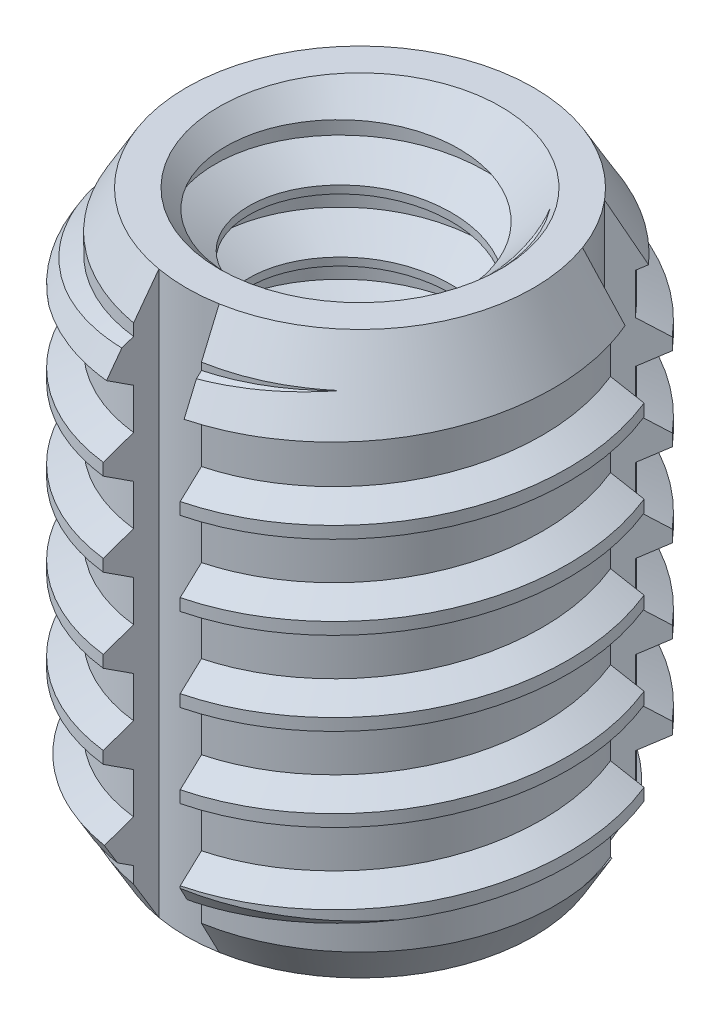
from build123d import *

# Parameters (mm, degrees)
SKETCH1_R         = 3.7592
EXTRUDE1_DEPTH    = 9.525
SKETCH4_R         = 1.725592336
EXTRUDE2_DEPTH    = 11.908198489
CHAMFER1_SIZE     = 0.661458333
CUT_SWEEP1_PITCH  = 1.058333333
CHAMFER2_SIZE     = 1.411111111
CHAMFER2_SIZE2    = 0.81470538
CHAMFER3_SIZE     = 1.411111111
CHAMFER3_SIZE2    = 0.81470538
CUT_SWEEP2_PITCH  = 1.411111111
EXTRUDE3_DEPTH    = 11.908198645
CIRPATTERN1_COUNT = 3


with BuildPart() as part:
    # Sketch1 → Extrude1 (new body)
    with BuildSketch(Plane(origin=(0, 0, 0), x_dir=(1, 0, 0), z_dir=(0, 1, 0))):
        with Locations(Location((0, 0, 0), (0, 0, 270))):
            Circle(SKETCH1_R)
    extrude(amount=-EXTRUDE1_DEPTH)

    # Sketch4 → Extrude2 (cut, through all)
    with BuildSketch(Plane(origin=(0, 0, 0), x_dir=(-1, 0, 0), z_dir=(0, 1, 0))):
        with Locations(Location((0, 0, 0), (0, 0, 90))):
            Circle(SKETCH4_R)
    extrude(amount=-EXTRUDE2_DEPTH, mode=Mode.SUBTRACT)

    # Chamfer1
    chamfer1_edges = [part.edges().sort_by_distance(p)[0] for p in [
        (0, -9.525, -1.725592336),
        (0, 0, -1.725592336),
    ]]
    chamfer(chamfer1_edges, length=CHAMFER1_SIZE)

    # Cut-Sweep1: the profile of Sketch3 screwed along a right-hand helix of 10 turns, 8 arcs to a turn; built about Z, then put on its axis
    cut_sweep1_z = Axis((0, 0, 0), (0, 0, 1))
    cut_sweep1_corners = [(2.298432056, 0, -0.5953125), (2.298432056, 0, -0.330729167), (1.668308364, 0, 0.033072917), (1.668308364, 0, -0.959114583)]
    with BuildLine(mode=Mode.PRIVATE) as cut_sweep1_profile:
        Line(cut_sweep1_corners[0], cut_sweep1_corners[1])
        Line(cut_sweep1_corners[1], cut_sweep1_corners[2])
        Line(cut_sweep1_corners[2], cut_sweep1_corners[3])
        Line(cut_sweep1_corners[3], cut_sweep1_corners[0])
    cut_sweep1_cap = Face(cut_sweep1_profile.wire())
    cut_sweep1_turn_angles = [0, 22.5, 45, 67.5, 90, 112.5, 135, 157.5, 180, 202.5, 225, 247.5, 270, 292.5, 315, 337.5, 360]
    cut_sweep1_turn_weights = [1, 0.9238795325112867, 1, 0.9238795325112867, 1, 0.9238795325112867, 1, 0.9238795325112867, 1, 0.9238795325112867, 1, 0.9238795325112867, 1, 0.9238795325112867, 1, 0.9238795325112867, 1]
    cut_sweep1_turn_rails = [Edge.make_bspline([Vector(p[0], p[1], 0).rotate(cut_sweep1_z, cut_sweep1_turn_angles[k]) / cut_sweep1_turn_weights[k] + Vector(0, 0, p[2] + CUT_SWEEP1_PITCH * cut_sweep1_turn_angles[k] / 360) for k in range(17)], [0, 0, 0, 1, 1, 2, 2, 3, 3, 4, 4, 5, 5, 6, 6, 7, 7, 8, 8, 8], 2, cut_sweep1_turn_weights) for p in cut_sweep1_corners]
    cut_sweep1_turn_sides = [Face.make_surface_from_curves(cut_sweep1_turn_rails[p[0]], cut_sweep1_turn_rails[p[1]]) for p in [(0, 1), (1, 2), (2, 3), (3, 0)]]
    cut_sweep1 = Plane(origin=(0, 0, 0), x_dir=(-1, 0, 0), z_dir=(0, -1, 0)) * Solid(Shell([*[p.moved(Location((0, 0, CUT_SWEEP1_PITCH * i))) for i in range(10) for p in cut_sweep1_turn_sides], cut_sweep1_cap, cut_sweep1_cap.rotate(cut_sweep1_z, 3600).moved(Location((0, 0, CUT_SWEEP1_PITCH * 3600 / 360)))]))
    add(cut_sweep1, mode=Mode.SUBTRACT)

    # Chamfer2
    chamfer2_edges = [part.edges().sort_by_distance(p)[0] for p in [
        (0, 0, -3.7592),
    ]]
    chamfer2_side = [part.faces().sort_by_distance(p)[0] for p in [
        (0, -4.7625, -3.7592),
    ]]
    chamfer(chamfer2_edges, length=CHAMFER2_SIZE, length2=CHAMFER2_SIZE2, reference=chamfer2_side[0])

    # Chamfer3
    chamfer3_edges = [part.edges().sort_by_distance(p)[0] for p in [
        (0, -9.525, -3.7592),
    ]]
    chamfer3_side = [part.faces().sort_by_distance(p)[0] for p in [
        (0, -5.468055556, -3.7592),
    ]]
    chamfer(chamfer3_edges, length=CHAMFER3_SIZE, length2=CHAMFER3_SIZE2, reference=chamfer3_side[0])

    # Cut-Sweep2: the profile of Sketch6 screwed along a right-hand helix of 7.5 turns, 8 arcs to a turn; built about Z, then put on its axis
    cut_sweep2_z = Axis((0, 0, 0), (0, 0, 1))
    cut_sweep2_corners = [(3.3147, 0, -0.950802571), (3.3147, 0, -0.256632195), (3.847394444, 0, 0.050919086), (3.847394444, 0, -1.258353852)]
    with BuildLine(mode=Mode.PRIVATE) as cut_sweep2_profile:
        Line(cut_sweep2_corners[0], cut_sweep2_corners[1])
        Line(cut_sweep2_corners[1], cut_sweep2_corners[2])
        Line(cut_sweep2_corners[2], cut_sweep2_corners[3])
        Line(cut_sweep2_corners[3], cut_sweep2_corners[0])
    cut_sweep2_cap = Face(cut_sweep2_profile.wire())
    cut_sweep2_turn_angles = [0, 22.5, 45, 67.5, 90, 112.5, 135, 157.5, 180, 202.5, 225, 247.5, 270, 292.5, 315, 337.5, 360]
    cut_sweep2_turn_weights = [1, 0.9238795325112867, 1, 0.9238795325112867, 1, 0.9238795325112867, 1, 0.9238795325112867, 1, 0.9238795325112867, 1, 0.9238795325112867, 1, 0.9238795325112867, 1, 0.9238795325112867, 1]
    cut_sweep2_turn_rails = [Edge.make_bspline([Vector(p[0], p[1], 0).rotate(cut_sweep2_z, cut_sweep2_turn_angles[k]) / cut_sweep2_turn_weights[k] + Vector(0, 0, p[2] + CUT_SWEEP2_PITCH * cut_sweep2_turn_angles[k] / 360) for k in range(17)], [0, 0, 0, 1, 1, 2, 2, 3, 3, 4, 4, 5, 5, 6, 6, 7, 7, 8, 8, 8], 2, cut_sweep2_turn_weights) for p in cut_sweep2_corners]
    cut_sweep2_turn_sides = [Face.make_surface_from_curves(cut_sweep2_turn_rails[p[0]], cut_sweep2_turn_rails[p[1]]) for p in [(0, 1), (1, 2), (2, 3), (3, 0)]]
    cut_sweep2_last_angles = [2520, 2542.5, 2565, 2587.5, 2610, 2632.5, 2655, 2677.5, 2700]
    cut_sweep2_last_weights = [1, 0.9238795325112867, 1, 0.9238795325112867, 1, 0.9238795325112867, 1, 0.9238795325112913, 1]
    cut_sweep2_last_rails = [Edge.make_bspline([Vector(p[0], p[1], 0).rotate(cut_sweep2_z, cut_sweep2_last_angles[k]) / cut_sweep2_last_weights[k] + Vector(0, 0, p[2] + CUT_SWEEP2_PITCH * cut_sweep2_last_angles[k] / 360) for k in range(9)], [0, 0, 0, 1, 1, 2, 2, 3, 3, 4, 4, 4], 2, cut_sweep2_last_weights) for p in cut_sweep2_corners]
    cut_sweep2_last_sides = [Face.make_surface_from_curves(cut_sweep2_last_rails[p[0]], cut_sweep2_last_rails[p[1]]) for p in [(0, 1), (1, 2), (2, 3), (3, 0)]]
    cut_sweep2 = Plane(origin=(0, 0, 0), x_dir=(-1, 0, 0), z_dir=(0, -1, 0)) * Solid(Shell([*[p.moved(Location((0, 0, CUT_SWEEP2_PITCH * i))) for i in range(7) for p in cut_sweep2_turn_sides], *cut_sweep2_last_sides, cut_sweep2_cap, cut_sweep2_cap.rotate(cut_sweep2_z, 2700).moved(Location((0, 0, CUT_SWEEP2_PITCH * 2700 / 360)))]))
    add(cut_sweep2, mode=Mode.SUBTRACT)

    # Sketch7 → Extrude3 (cut, through all)
    with BuildSketch(Plane(origin=(0, 0, 0), x_dir=(1, 0, 0), z_dir=(0, 1, 0))):
        with BuildLine():
            Line((-0.511306125, -2.899761131), (-0.652778229, -3.702089305))
            ThreePointArc((-0.652778229, -3.702089305), (0, -3.7592), (0.652778229, -3.702089305))
            Line((0.652778229, -3.702089305), (0.511306125, -2.899761131))
            ThreePointArc((0.511306125, -2.899761131), (0, -2.94449462), (-0.511306125, -2.899761131))
        make_face()
    extrude3 = extrude(amount=-EXTRUDE3_DEPTH, mode=Mode.SUBTRACT)

    # CirPattern1: Extrude3 ×3 about axis
    cirpattern1_axis = Axis((0, 0, 0), (0, 1, 0))
    for i in range(1, CIRPATTERN1_COUNT):
        add(extrude3.rotate(cirpattern1_axis, i * 360 / CIRPATTERN1_COUNT), mode=Mode.SUBTRACT)


solid = part.part
